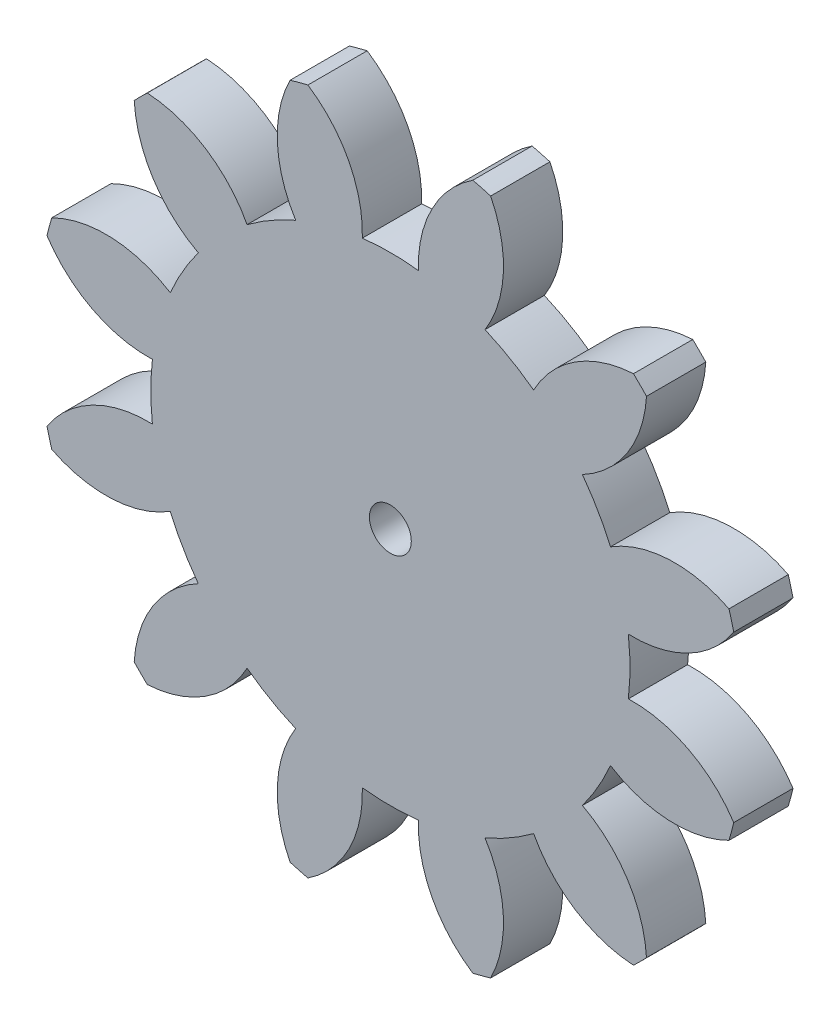
from build123d import *

# Parameters (mm, degrees)
SKETCH1_R           = 0.83
BOSS_EXTRUDE1_DEPTH = 2.35


with BuildPart() as part:
    # Sketch1 → Boss-Extrude1 (new body)
    with BuildSketch(Plane.XY):
        with BuildLine():
            ThreePointArc((31.089190509, -0.00961289), (28.777823425, -0.762116774), (27.131493603, -2.550489779))
            ThreePointArc((27.131493603, -2.550489779), (26.201203233, -1.937982234), (25.205610954, -1.438580913))
            ThreePointArc((25.205610954, -1.438580913), (25.931222497, 0.881369039), (25.427226435, 3.259323592))
            ThreePointArc((25.427226435, 3.259323592), (25.075169864, 3.358604023), (24.720639715, 3.448652933))
            ThreePointArc((24.720639715, 3.448652933), (23.095189045, 1.641281911), (22.563612099, -0.730659454))
            ThreePointArc((22.563612099, -0.730659454), (21.451703233, -0.665357545), (20.339794367, -0.730659454))
            ThreePointArc((20.339794367, -0.730659454), (19.80821742, 1.641281911), (18.182766751, 3.448652933))
            ThreePointArc((18.182766751, 3.448652933), (17.828236601, 3.358604023), (17.47618003, 3.259323592))
            ThreePointArc((17.47618003, 3.259323592), (16.972183969, 0.881369039), (17.697795512, -1.438580913))
            ThreePointArc((17.697795512, -1.438580913), (16.702203233, -1.937982234), (15.771912863, -2.550489779))
            ThreePointArc((15.771912863, -2.550489779), (14.12558304, -0.762116774), (11.814215957, -0.00961289))
            ThreePointArc((11.814215957, -0.00961289), (11.552208296, -0.264862608), (11.296958578, -0.526870269))
            ThreePointArc((11.296958578, -0.526870269), (12.049462462, -2.838237352), (13.837835467, -4.484567174))
            ThreePointArc((13.837835467, -4.484567174), (13.225327922, -5.414857545), (12.725926601, -6.410449824))
            ThreePointArc((12.725926601, -6.410449824), (10.40597665, -5.684838281), (8.028022096, -6.188834342))
            ThreePointArc((8.028022096, -6.188834342), (7.928741665, -6.540890913), (7.838692755, -6.895421063))
            ThreePointArc((7.838692755, -6.895421063), (9.646063777, -8.520871732), (12.018005142, -9.052448679))
            ThreePointArc((12.018005142, -9.052448679), (11.952703233, -10.164357545), (12.018005142, -11.276266411))
            ThreePointArc((12.018005142, -11.276266411), (9.646063777, -11.807843357), (7.838692755, -13.433294027))
            ThreePointArc((7.838692755, -13.433294027), (7.928741665, -13.787824176), (8.028022096, -14.139880747))
            ThreePointArc((8.028022096, -14.139880747), (10.40597665, -14.643876808), (12.725926601, -13.918265265))
            ThreePointArc((12.725926601, -13.918265265), (13.225327922, -14.913857545), (13.837835467, -15.844147915))
            ThreePointArc((13.837835467, -15.844147915), (12.049462462, -17.490477737), (11.296958578, -19.80184482))
            ThreePointArc((11.296958578, -19.80184482), (11.552208296, -20.063852481), (11.814215957, -20.3191022))
            ThreePointArc((11.814215957, -20.3191022), (14.12558304, -19.566598315), (15.771912863, -17.77822531))
            ThreePointArc((15.771912863, -17.77822531), (16.702203233, -18.390732855), (17.697795512, -18.890134176))
            ThreePointArc((17.697795512, -18.890134176), (16.972183969, -21.210084128), (17.47618003, -23.588038682))
            ThreePointArc((17.47618003, -23.588038682), (17.828236601, -23.687319113), (18.182766751, -23.777368023))
            ThreePointArc((18.182766751, -23.777368023), (19.80821742, -21.969997001), (20.339794367, -19.598055636))
            ThreePointArc((20.339794367, -19.598055636), (21.451703233, -19.663357545), (22.563612099, -19.598055636))
            ThreePointArc((22.563612099, -19.598055636), (23.095189045, -21.969997001), (24.720639715, -23.777368023))
            ThreePointArc((24.720639715, -23.777368023), (25.075169864, -23.687319113), (25.427226435, -23.588038682))
            ThreePointArc((25.427226435, -23.588038682), (25.931222497, -21.210084128), (25.205610954, -18.890134176))
            ThreePointArc((25.205610954, -18.890134176), (26.201203233, -18.390732855), (27.131493603, -17.77822531))
            ThreePointArc((27.131493603, -17.77822531), (28.777823425, -19.566598315), (31.089190509, -20.3191022))
            ThreePointArc((31.089190509, -20.3191022), (31.351198169, -20.063852481), (31.606447888, -19.80184482))
            ThreePointArc((31.606447888, -19.80184482), (30.853944004, -17.490477737), (29.065570998, -15.844147915))
            ThreePointArc((29.065570998, -15.844147915), (29.678078543, -14.913857545), (30.177479864, -13.918265265))
            ThreePointArc((30.177479864, -13.918265265), (32.497429816, -14.643876808), (34.87538437, -14.139880747))
            ThreePointArc((34.87538437, -14.139880747), (34.974664801, -13.787824176), (35.064713711, -13.433294027))
            ThreePointArc((35.064713711, -13.433294027), (33.257342689, -11.807843357), (30.885401324, -11.276266411))
            ThreePointArc((30.885401324, -11.276266411), (30.950703233, -10.164357545), (30.885401324, -9.052448679))
            ThreePointArc((30.885401324, -9.052448679), (33.257342689, -8.520871732), (35.064713711, -6.895421063))
            ThreePointArc((35.064713711, -6.895421063), (34.974664801, -6.540890913), (34.87538437, -6.188834342))
            ThreePointArc((34.87538437, -6.188834342), (32.497429816, -5.684838281), (30.177479864, -6.410449824))
            ThreePointArc((30.177479864, -6.410449824), (29.678078543, -5.414857545), (29.065570998, -4.484567174))
            ThreePointArc((29.065570998, -4.484567174), (30.853944004, -2.838237352), (31.606447888, -0.526870269))
            ThreePointArc((31.606447888, -0.526870269), (31.351198169, -0.264862608), (31.089190509, -0.00961289))
        make_face()
        with Locations((21.451703233, -10.164357545)):
            Circle(SKETCH1_R, mode=Mode.SUBTRACT)
    extrude(amount=BOSS_EXTRUDE1_DEPTH)


solid = part.part
